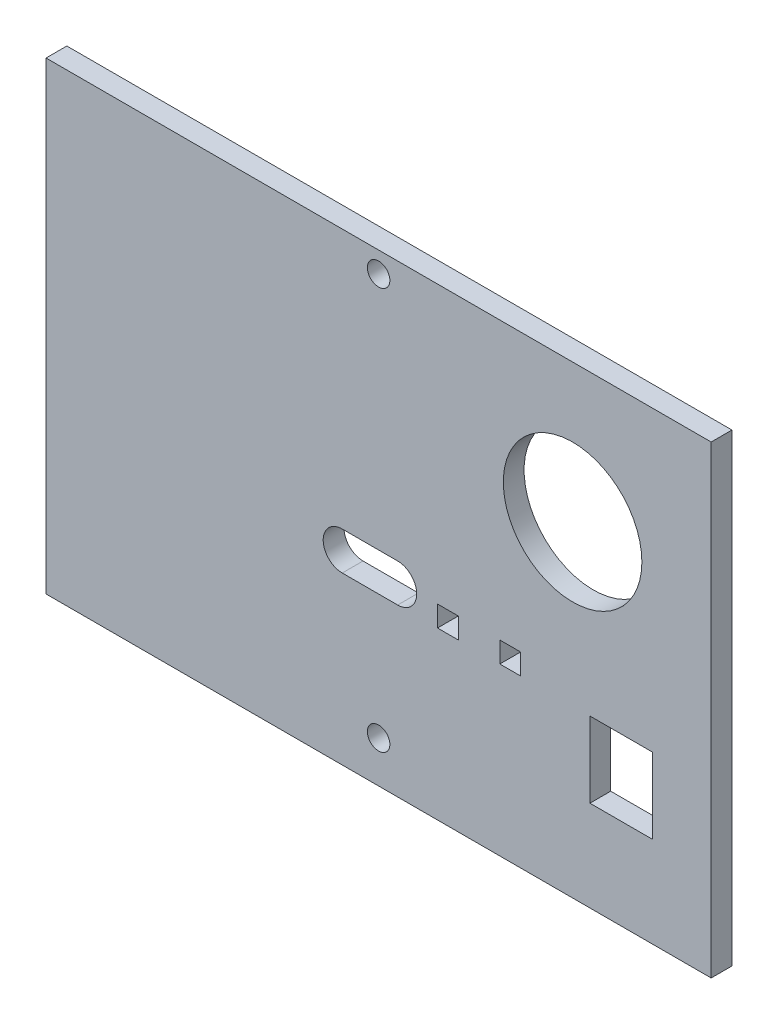
from build123d import *

# Parameters (mm, degrees)
CROQUIS6_W              = 96
CROQUIS6_H              = 67
SALIENTE_EXTRUIR1_DEPTH = 3
CROQUIS7_R              = 1.625
CROQUIS7_R_2            = 10
CROQUIS7_W              = 9
CROQUIS7_H              = 10.9
CROQUIS7_W_2            = 3
CROQUIS7_H_2            = 3
CORTAR_EXTRUIR1_DEPTH   = 59.611005792


with BuildPart() as part:
    # Croquis6 → Saliente-Extruir1 (new body)
    with BuildSketch(Plane.XY):
        Rectangle(CROQUIS6_W, CROQUIS6_H)
    extrude(amount=SALIENTE_EXTRUIR1_DEPTH)

    # Croquis7 → Cortar-Extruir1 (cut, through all)
    with BuildSketch(Plane.XY):
        with Locations((0, -27.5)):
            Circle(CROQUIS7_R)
        with Locations((0, 30.5)):
            Circle(CROQUIS7_R)
        with Locations((28, 13.5)):
            Circle(CROQUIS7_R_2)
        with Locations((35, -14.95)):
            Rectangle(CROQUIS7_W, CROQUIS7_H)
        with BuildLine():
            Line((2.75, -9.5), (-5.25, -9.5))
            ThreePointArc((-5.25, -9.5), (-8, -6.75), (-5.25, -4))
            Line((-5.25, -4), (2.75, -4))
            ThreePointArc((2.75, -4), (5.5, -6.75), (2.75, -9.5))
        make_face()
        with Locations((10, -8)):
            Rectangle(CROQUIS7_W_2, CROQUIS7_H_2)
        with Locations((19, -8)):
            Rectangle(CROQUIS7_W_2, CROQUIS7_H_2)
    extrude(amount=CORTAR_EXTRUIR1_DEPTH, mode=Mode.SUBTRACT)


solid = part.part
